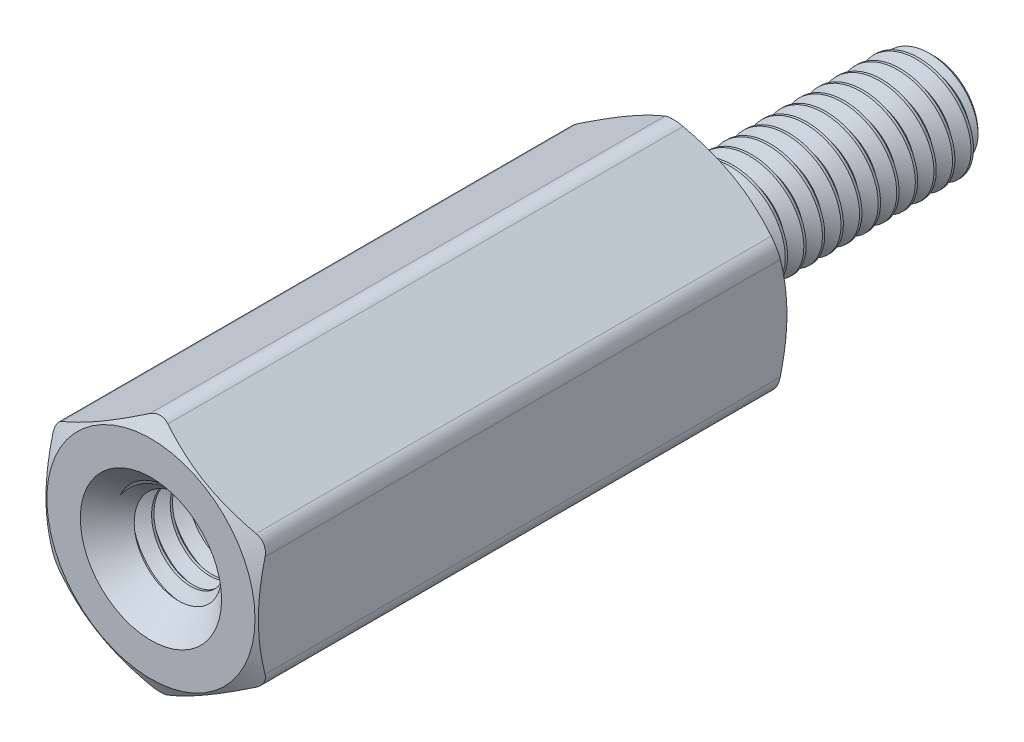
from build123d import *

# Parameters (mm, degrees)
SKETCH4_R           = 3
BOSS_EXTRUDE1_DEPTH = 20
SKETCH5_OUTSIDE_W   = 124.21
SKETCH5_OUTSIDE_H   = 125.448
SKETCH5_OUTSIDE_R   = 3.92
CUT_EXTRUDE1_DEPTH  = 31.126123769
CUT_EXTRUDE1_DRAFT  = -60
SKETCH6_OUTSIDE_W   = 92.294
SKETCH6_OUTSIDE_H   = 93.532
SKETCH6_OUTSIDE_R   = 3.92
CUT_EXTRUDE2_DEPTH  = 21.912516188
CUT_EXTRUDE2_DRAFT  = -60
FILLET1_R           = 0.68
CUT_SWEEP1_PITCH    = 0.7
SKETCH9_R           = 2.35
BOSS_EXTRUDE2_DEPTH = 11.1
SKETCH10_W          = 11.1
SKETCH10_H          = 2
CUT_SWEEP2_PITCH    = 0.7


with BuildPart() as part:
    # Sketch3 → Revolve1 (revolve)
    with BuildSketch(Plane(origin=(0, 0, 0), x_dir=(0, 0, -1), z_dir=(1, 0, 0))):
        with BuildLine():
            Line((-8.9, 1.65), (-8.9, 0))
            Line((-8.9, 0), (9.5, 0))
            Line((9.5, 0), (9.5, 1.65))
            Line((9.5, 1.65), (9.15, 2))
            Line((9.15, 2), (1.4025, 2))
            Line((1.4025, 2), (1.14, 1.545336663))
            Line((1.14, 1.545336663), (0.35, 1.545336663))
            ThreePointArc((0.35, 1.545336663), (0.102512627, 1.64784929), (0, 1.895336663))
            Line((0, 1.895336663), (0, 4))
            Line((0, 4), (-20, 4))
            Line((-20, 4), (-20, 2.35))
            Line((-20, 2.35), (-19.65, 2))
            Line((-19.65, 2), (-9.25, 2))
            Line((-9.25, 2), (-8.9, 1.65))
        make_face()
    revolve(axis=Axis((0, 0, -9.5), (0, 0, 1)))

    # Sketch4 → Boss-Extrude1 (add)
    with BuildSketch(Plane.XY.offset(20)):
        Polygon((-4, 2.309401077), (-4, -2.309401077), (0, -4.618802154), (4, -2.309401077), (4, 2.309401077), (0, 4.618802154), align=None)
        Circle(SKETCH4_R, mode=Mode.SUBTRACT)
    extrude(amount=-BOSS_EXTRUDE1_DEPTH)


with BuildPart() as cut_extrude1_tool:
    # Sketch5 outside → Cut-Extrude1 (with draft: the straight prism first)
    with BuildSketch(Plane.XY.offset(20)):
        Rectangle(SKETCH5_OUTSIDE_W, SKETCH5_OUTSIDE_H)
        Circle(SKETCH5_OUTSIDE_R, mode=Mode.SUBTRACT)
    extrude(amount=-CUT_EXTRUDE1_DEPTH)
    # Cut-Extrude1: the draft: its side faces are tilted about the plane it starts from
    cut_extrude1_sides = [cut_extrude1_tool.faces().sort_by_distance(p)[0] for p in [
        (0, -62.724, 4.436938116),
        (62.105, 0, 4.436938116),
        (0, 62.724, 4.436938116),
        (-62.105, 0, 4.436938116),
        (-3.92, 0, 4.436938116),
    ]]
    draft(cut_extrude1_sides, Plane.XY.offset(20), CUT_EXTRUDE1_DRAFT)


with BuildPart() as part_1:
    add(part.part)

    # Cut-Extrude1: cut by cut_extrude1_tool
    add(cut_extrude1_tool.part, mode=Mode.SUBTRACT)


with BuildPart() as cut_extrude2_tool:
    # Sketch6 outside → Cut-Extrude2 (with draft: the straight prism first)
    with BuildSketch(Plane(origin=(0, 0, 0), x_dir=(-1, 0, 0), z_dir=(0, 0, -1))):
        Rectangle(SKETCH6_OUTSIDE_W, SKETCH6_OUTSIDE_H)
        Circle(SKETCH6_OUTSIDE_R, mode=Mode.SUBTRACT)
    extrude(amount=-CUT_EXTRUDE2_DEPTH)
    # Cut-Extrude2: the draft: its side faces are tilted about the plane it starts from
    cut_extrude2_sides = [cut_extrude2_tool.faces().sort_by_distance(p)[0] for p in [
        (0, -46.766, 10.956258094),
        (-46.147, 0, 10.956258094),
        (0, 46.766, 10.956258094),
        (46.147, 0, 10.956258094),
        (3.92, 0, 10.956258094),
    ]]
    draft(cut_extrude2_sides, Plane(origin=(0, 0, 0), x_dir=(-1, 0, 0), z_dir=(0, 0, -1)), CUT_EXTRUDE2_DRAFT)


with BuildPart() as part_2:
    add(part_1.part)

    # Cut-Extrude2: cut by cut_extrude2_tool
    add(cut_extrude2_tool.part, mode=Mode.SUBTRACT)

    # Fillet1
    fillet1_edges = [part_2.edges().sort_by_distance(p)[0] for p in [
        (0, 4.618802154, 10),
        (-4, -2.309401077, 10),
        (0, -4.618802154, 10),
        (4, -2.309401077, 10),
        (4, 2.309401077, 10),
        (-4, 2.309401077, 10),
    ]]
    fillet(fillet1_edges, radius=FILLET1_R)

    # Cut-Sweep1: the profile of Sketch7 profile screwed along a right-hand helix of 13.164286 turns, 6 arcs to a turn; built about Z, then put on its axis
    cut_sweep1_z = Axis((0, 0, 0), (0, 0, 1))
    cut_sweep1_corners = [(1.545036663, 0, -0.262673205), (1.545036663, 0, -0.349826795), (2.037888611, 0, -0.634375), (2.037888611, 0, 0.021875)]
    with BuildLine(mode=Mode.PRIVATE) as cut_sweep1_profile:
        Line(cut_sweep1_corners[0], cut_sweep1_corners[1])
        Line(cut_sweep1_corners[1], cut_sweep1_corners[2])
        Line(cut_sweep1_corners[2], cut_sweep1_corners[3])
        Line(cut_sweep1_corners[3], cut_sweep1_corners[0])
    cut_sweep1_cap = Face(cut_sweep1_profile.wire())
    cut_sweep1_turn_angles = [0, 30, 60, 90, 120, 150, 180, 210, 240, 270, 300, 330, 360]
    cut_sweep1_turn_weights = [1, 0.8660254037844387, 1, 0.8660254037844387, 1, 0.8660254037844387, 1, 0.8660254037844387, 1, 0.8660254037844387, 1, 0.8660254037844387, 1]
    cut_sweep1_turn_rails = [Edge.make_bspline([Vector(p[0], p[1], 0).rotate(cut_sweep1_z, cut_sweep1_turn_angles[k]) / cut_sweep1_turn_weights[k] + Vector(0, 0, p[2] + CUT_SWEEP1_PITCH * cut_sweep1_turn_angles[k] / 360) for k in range(13)], [0, 0, 0, 1, 1, 2, 2, 3, 3, 4, 4, 5, 5, 6, 6, 6], 2, cut_sweep1_turn_weights) for p in cut_sweep1_corners]
    cut_sweep1_turn_sides = [Face.make_surface_from_curves(cut_sweep1_turn_rails[p[0]], cut_sweep1_turn_rails[p[1]]) for p in [(0, 1), (1, 2), (2, 3), (3, 0)]]
    cut_sweep1_last_angles = [4680, 4709.571428571, 4739.142857143]
    cut_sweep1_last_weights = [1, 0.8697411331556261, 1]
    cut_sweep1_last_rails = [Edge.make_bspline([Vector(p[0], p[1], 0).rotate(cut_sweep1_z, cut_sweep1_last_angles[k]) / cut_sweep1_last_weights[k] + Vector(0, 0, p[2] + CUT_SWEEP1_PITCH * cut_sweep1_last_angles[k] / 360) for k in range(3)], [0, 0, 0, 1, 1, 1], 2, cut_sweep1_last_weights) for p in cut_sweep1_corners]
    cut_sweep1_last_sides = [Face.make_surface_from_curves(cut_sweep1_last_rails[p[0]], cut_sweep1_last_rails[p[1]]) for p in [(0, 1), (1, 2), (2, 3), (3, 0)]]
    cut_sweep1 = Plane(origin=(0, 0, -9.5), x_dir=(0, 1, 0), z_dir=(0, 0, 1)) * Solid(Shell([*[p.moved(Location((0, 0, CUT_SWEEP1_PITCH * i))) for i in range(13) for p in cut_sweep1_turn_sides], *cut_sweep1_last_sides, cut_sweep1_cap, cut_sweep1_cap.rotate(cut_sweep1_z, 4739.142857143).moved(Location((0, 0, CUT_SWEEP1_PITCH * 4739.142857143 / 360)))]))
    add(cut_sweep1, mode=Mode.SUBTRACT)

    # Sketch9 → Boss-Extrude2 (add)
    with BuildSketch(Plane.XY.offset(8.9)):
        Circle(SKETCH9_R)
    extrude(amount=BOSS_EXTRUDE2_DEPTH)


with BuildPart() as body_2:
    # Sketch10 → Revolve2 (revolve)
    with BuildSketch(Plane(origin=(0, 0, 0), x_dir=(0, 0, -1), z_dir=(1, 0, 0))):
        with Locations((-14.45, 1)):
            Rectangle(SKETCH10_W, SKETCH10_H)
    revolve(axis=Axis((0, 0, -9.5), (0, 0, 1)))

    # Cut-Sweep2: the profile of Sketch12 profile screwed along a right-hand helix of 16.857143 turns, 6 arcs to a turn; built about Z, then put on its axis
    cut_sweep2_z = Axis((0, 0, 0), (0, 0, 1))
    cut_sweep2_corners = [(1.545036663, 0, -0.349826795), (1.545036663, 0, -0.262673205), (2.037888611, 0, 0.021875), (2.037888611, 0, -0.634375)]
    with BuildLine(mode=Mode.PRIVATE) as cut_sweep2_profile:
        Line(cut_sweep2_corners[0], cut_sweep2_corners[1])
        Line(cut_sweep2_corners[1], cut_sweep2_corners[2])
        Line(cut_sweep2_corners[2], cut_sweep2_corners[3])
        Line(cut_sweep2_corners[3], cut_sweep2_corners[0])
    cut_sweep2_cap = Face(cut_sweep2_profile.wire())
    cut_sweep2_turn_angles = [0, 30, 60, 90, 120, 150, 180, 210, 240, 270, 300, 330, 360]
    cut_sweep2_turn_weights = [1, 0.8660254037844387, 1, 0.8660254037844387, 1, 0.8660254037844387, 1, 0.8660254037844387, 1, 0.8660254037844387, 1, 0.8660254037844387, 1]
    cut_sweep2_turn_rails = [Edge.make_bspline([Vector(p[0], p[1], 0).rotate(cut_sweep2_z, cut_sweep2_turn_angles[k]) / cut_sweep2_turn_weights[k] + Vector(0, 0, p[2] + CUT_SWEEP2_PITCH * cut_sweep2_turn_angles[k] / 360) for k in range(13)], [0, 0, 0, 1, 1, 2, 2, 3, 3, 4, 4, 5, 5, 6, 6, 6], 2, cut_sweep2_turn_weights) for p in cut_sweep2_corners]
    cut_sweep2_turn_sides = [Face.make_surface_from_curves(cut_sweep2_turn_rails[p[0]], cut_sweep2_turn_rails[p[1]]) for p in [(0, 1), (1, 2), (2, 3), (3, 0)]]
    cut_sweep2_last_angles = [5760, 5790, 5820, 5850, 5880, 5910, 5940, 5970, 6000, 6030, 6060, 6064.285714286, 6068.571428571]
    cut_sweep2_last_weights = [1, 0.8660254037844387, 1, 0.8660254037844387, 1, 0.8660254037844387, 1, 0.8660254037844387, 1, 0.8660254037844387, 1, 0.997203797181163, 1]
    cut_sweep2_last_rails = [Edge.make_bspline([Vector(p[0], p[1], 0).rotate(cut_sweep2_z, cut_sweep2_last_angles[k]) / cut_sweep2_last_weights[k] + Vector(0, 0, p[2] + CUT_SWEEP2_PITCH * cut_sweep2_last_angles[k] / 360) for k in range(13)], [0, 0, 0, 1, 1, 2, 2, 3, 3, 4, 4, 5, 5, 6, 6, 6], 2, cut_sweep2_last_weights) for p in cut_sweep2_corners]
    cut_sweep2_last_sides = [Face.make_surface_from_curves(cut_sweep2_last_rails[p[0]], cut_sweep2_last_rails[p[1]]) for p in [(0, 1), (1, 2), (2, 3), (3, 0)]]
    cut_sweep2 = Plane(origin=(0, 0, 20), x_dir=(0, 1, 0), z_dir=(0, 0, -1)) * Solid(Shell([*[p.moved(Location((0, 0, CUT_SWEEP2_PITCH * i))) for i in range(16) for p in cut_sweep2_turn_sides], *cut_sweep2_last_sides, cut_sweep2_cap, cut_sweep2_cap.rotate(cut_sweep2_z, 6068.571428571).moved(Location((0, 0, CUT_SWEEP2_PITCH * 6068.571428571 / 360)))]))
    add(cut_sweep2, mode=Mode.SUBTRACT)


with BuildPart() as part_3:
    add(part_2.part)

    # Combine1: cut body 2
    add(body_2.part, mode=Mode.SUBTRACT)

    # Cut-Extrude3 cone 1 section (through the dimple's axis) → Cut-Extrude3 (revolve, cut)
    with BuildSketch(Plane(origin=(0, 0, 20), x_dir=(0, -1, 0), z_dir=(1, 0, 0))):
        Polygon((0, 0), (2.66, 0), (0, 2.66), align=None)
    revolve(axis=Axis((0, 0, 20), (0, 0, -1)), mode=Mode.SUBTRACT)


solid = part_3.part
